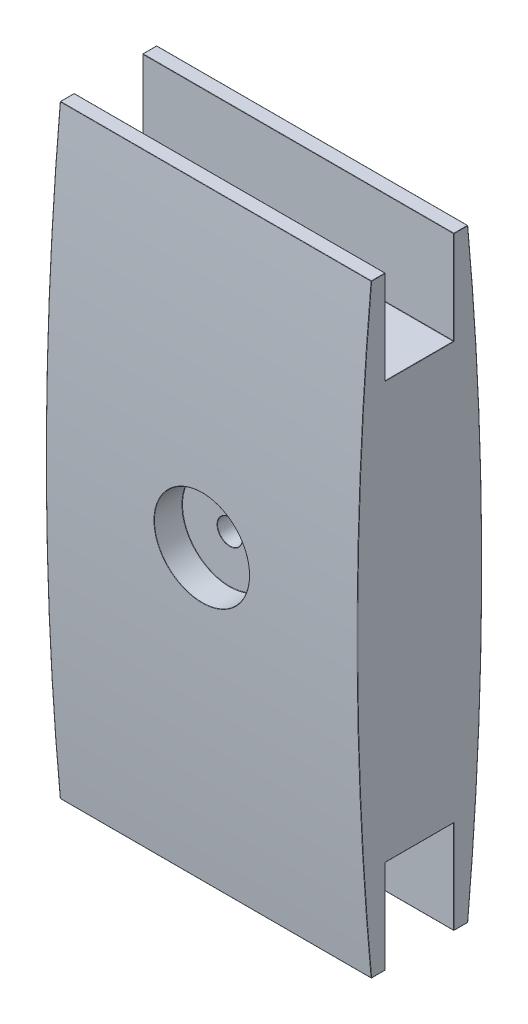
from build123d import *

# Parameters (mm, degrees)
BOSS_EXTRUDE1_DEPTH     = 100
SKETCH4_R               = 15.278631479
CUT_EXTRUDE1_DEPTH      = 9
CUT_EXTRUDE2_DEPTH      = 145.94481725
CUT_EXTRUDE2_DEPTH_BACK = 145.94481725
SKETCH5_R               = 4
FILLET1_R               = 0.1


with BuildPart() as part:
    # Sketch2 → Boss-Extrude1 (new body)
    with BuildSketch(Plane(origin=(0, 0, 0), x_dir=(0, 0, -1), z_dir=(1, 0, 0))):
        with BuildLine():
            Line((-11, 97), (-11, 67))
            Line((-11, 67), (11, 67))
            Line((11, 67), (11, 97))
            Line((11, 97), (15.5, 97))
            ThreePointArc((15.5, 97), (20, 0), (15.5, -97))
            Line((15.5, -97), (11, -97))
            Line((11, -97), (11, -67))
            Line((11, -67), (-11, -67))
            Line((-11, -67), (-11, -97))
            Line((-11, -97), (-15.5, -97))
            ThreePointArc((-15.5, -97), (-20, 0), (-15.5, 97))
            Line((-15.5, 97), (-11, 97))
        make_face()
    extrude(amount=BOSS_EXTRUDE1_DEPTH)

    # Sketch4 → Cut-Extrude1 (cut)
    with BuildSketch(Plane.XY.offset(20)):
        with Locations((50, 0)):
            Circle(SKETCH4_R)
    cut_extrude1 = extrude(amount=-CUT_EXTRUDE1_DEPTH, mode=Mode.SUBTRACT)

    # Mirror1: Cut-Extrude1 across plane
    add(cut_extrude1.mirror(Plane.XY), mode=Mode.SUBTRACT)

    # Sketch5 → Cut-Extrude2 (cut, two sides: drawn at the far end of the back side and taken through both)
    with BuildSketch(Plane.XY.offset(20).offset(-CUT_EXTRUDE2_DEPTH_BACK)):
        with Locations((50, 0)):
            Circle(SKETCH5_R)
    extrude(amount=CUT_EXTRUDE2_DEPTH + CUT_EXTRUDE2_DEPTH_BACK, mode=Mode.SUBTRACT)

    # Fillet1
    fillet1_edges = [part.edges().sort_by_distance(p)[0] for p in [
        (50, 97, 11),
        (50, 97, -11),
        (50, 67, -11),
        (50, 67, 11),
        (46, 0, 11),
        (34.721368521, 0, 11),
        (50, -97, 11),
        (50, -97, -11),
        (50, -67, 11),
        (50, -67, -11),
        (100, 97, -13.25),
        (100, -97, -13.25),
        (100, -82, -11),
        (100, -67, 0),
        (100, -82, 11),
        (100, -97, 13.25),
        (100, 97, 13.25),
        (100, 82, 11),
        (100, 67, 0),
        (100, 82, -11),
        (50, 97, 15.5),
        (100, 0, 20),
        (50, -97, 15.5),
        (34.721368518, 0, 20.000000003),
        (34.721368521, 0, -11),
        (46, 0, -11),
        (34.721368517, 4e-09, -20.000000003),
        (50, -97, -15.5),
        (100, 0, -20),
        (50, 97, -15.5),
        (0, 67, 0),
        (0, 82, 11),
        (0, 97, 13.25),
        (0, 0, 20),
        (0, -97, 13.25),
        (0, -82, 11),
        (0, -67, 0),
        (0, -82, -11),
        (0, -97, -13.25),
        (0, 0, -20),
        (0, 97, -13.25),
        (0, 82, -11),
    ]]
    fillet(fillet1_edges, radius=FILLET1_R)


solid = part.part
